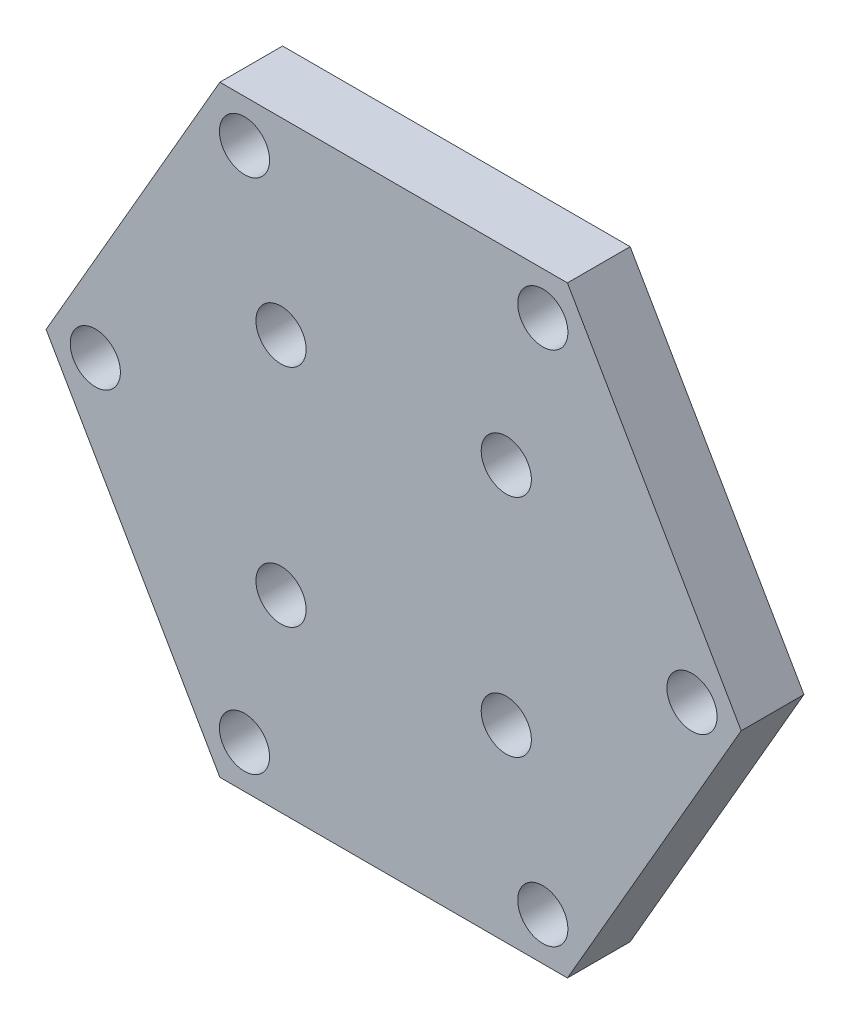
from build123d import *

# Parameters (mm, degrees)
EXTRUDE_1_DEPTH     = 5
SKETCH_11_R         = 21.35
CUT_EXTRUDE_1_DEPTH = 1
F_4_0MM_2_D         = 4
F_4_0MM_3_OUTLINE_R = 2
F_4_0MM_3_DEPTH     = 5


# Read off the part's stored shape, not the designer's step: Ø4.0mm 暗销孔3
with BuildPart() as part:
    # 草图2 → 凸台-拉伸1 (new body)
    with BuildSketch(Plane.XY):
        Polygon((-13.856406461, 24), (-27.712812921, 0), (-13.856406461, -24), (13.856406461, -24), (27.712812921, 0), (13.856406461, 24), align=None)
    extrude(amount=EXTRUDE_1_DEPTH)

    # 草图11 → 切除-拉伸1 (cut)
    with BuildSketch(Plane(origin=(0, 0, 0), x_dir=(-1, 0, 0), z_dir=(0, 0, -1))):
        Circle(SKETCH_11_R)
    extrude(amount=-CUT_EXTRUDE_1_DEPTH, mode=Mode.SUBTRACT)

    # Ø4.0mm 暗销孔2 (through all)
    with Locations(Plane(origin=(0, 0, 1), x_dir=(-1, 0, 0), z_dir=(0, 0, -1))):
        with Locations((8.980256121, 8.980256121), (-8.980256121, 8.980256121), (-8.980256121, -8.980256121), (8.980256121, -8.980256121)):
            Hole(F_4_0MM_2_D / 2)

    # Ø4.0mm 暗销孔3 outline → Ø4.0mm 暗销孔3 (cut)
    with BuildSketch(Plane.XY):
        with Locations((23.786831091, 0)):
            Circle(F_4_0MM_3_OUTLINE_R)
        with Locations((-11.893415545, -20.6)):
            Circle(F_4_0MM_3_OUTLINE_R)
        with Locations((11.893415545, -20.6)):
            Circle(F_4_0MM_3_OUTLINE_R)
        with Locations((-23.786831091, 0)):
            Circle(F_4_0MM_3_OUTLINE_R)
        with Locations((-11.893415545, 20.6)):
            Circle(F_4_0MM_3_OUTLINE_R)
        with Locations((11.893415545, 20.6)):
            Circle(F_4_0MM_3_OUTLINE_R)
    extrude(amount=F_4_0MM_3_DEPTH, mode=Mode.SUBTRACT)


solid = part.part
